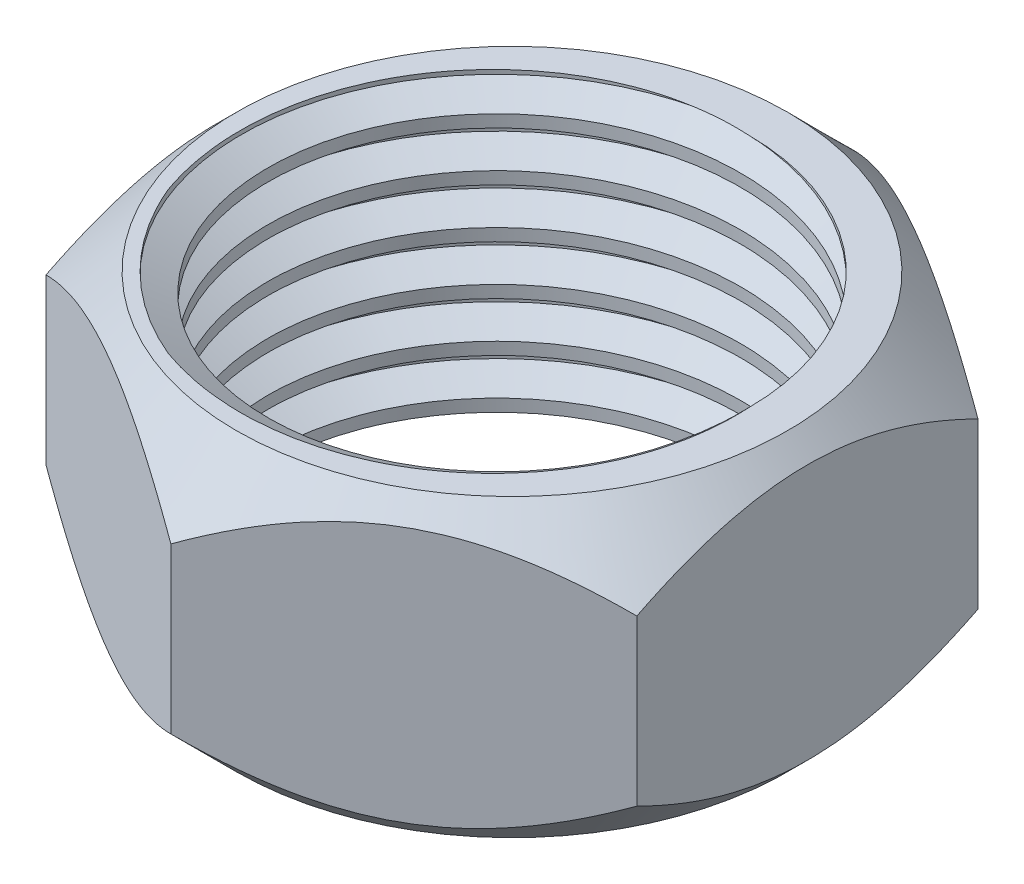
from build123d import *

# Parameters (mm, degrees)
BOSS_EXTRUDE1_DEPTH     = 3.75
SKETCH9_OUTSIDE_W       = 51.208
SKETCH9_OUTSIDE_H       = 53.528
SKETCH9_OUTSIDE_R       = 7
CUT_EXTRUDE3_DEPTH      = 14.693063938
CUT_EXTRUDE3_DRAFT      = -45
MIRROR1_COPY_1_SKETCH_W = 51.208
MIRROR1_COPY_1_SKETCH_H = 53.528
MIRROR1_COPY_1_SKETCH_R = 7
MIRROR1_COPY_1_DEPTH    = 14.693063938
MIRROR1_COPY_1_DRAFT    = -45
SKETCH10_R              = 6
CUT_EXTRUDE4_DEPTH      = 14.693063938
THREAD1_PITCH           = 1.25


with BuildPart() as part:
    # Sketch1 → Boss-Extrude1 (new, symmetric)
    with BuildSketch(Plane(origin=(0, 0, 0), x_dir=(1, 0, 0), z_dir=(0, 1, 0))):
        Polygon((0, 8.660254038), (-7.5, 4.330127019), (-7.5, -4.330127019), (0, -8.660254038), (7.5, -4.330127019), (7.5, 4.330127019), align=None)
    extrude(amount=BOSS_EXTRUDE1_DEPTH, both=True)


with BuildPart() as cut_extrude3_tool:
    # Sketch9 outside → Cut-Extrude3 (with draft: the straight prism first)
    with BuildSketch(Plane(origin=(0, 3.75, 0), x_dir=(1, 0, 0), z_dir=(0, 1, 0))):
        Rectangle(SKETCH9_OUTSIDE_W, SKETCH9_OUTSIDE_H)
        Circle(SKETCH9_OUTSIDE_R, mode=Mode.SUBTRACT)
    extrude(amount=-CUT_EXTRUDE3_DEPTH)
    # Cut-Extrude3: the draft: its side faces are tilted about the plane it starts from
    cut_extrude3_sides = [cut_extrude3_tool.faces().sort_by_distance(p)[0] for p in [
        (0, -3.596531969, 26.764),
        (25.604, -3.596531969, 0),
        (0, -3.596531969, -26.764),
        (-25.604, -3.596531969, 0),
        (-7, -3.596531969, 0),
    ]]
    draft(cut_extrude3_sides, Plane(origin=(0, 3.75, 0), x_dir=(1, 0, 0), z_dir=(0, 1, 0)), CUT_EXTRUDE3_DRAFT)


with BuildPart() as part_1:
    add(part.part)

    # Cut-Extrude3: cut by cut_extrude3_tool
    add(cut_extrude3_tool.part, mode=Mode.SUBTRACT)


with BuildPart() as mirror1_copy_1_tool:
    # Mirror1 copy 1 sketch → Mirror1 copy 1 (with draft: the straight prism first)
    with BuildSketch(Plane.XZ.offset(3.75)):
        Rectangle(MIRROR1_COPY_1_SKETCH_W, MIRROR1_COPY_1_SKETCH_H)
        Circle(MIRROR1_COPY_1_SKETCH_R, mode=Mode.SUBTRACT)
    extrude(amount=-MIRROR1_COPY_1_DEPTH)
    # Mirror1 copy 1: the draft: its side faces are tilted about the plane it starts from
    mirror1_copy_1_sides = [mirror1_copy_1_tool.faces().sort_by_distance(p)[0] for p in [
        (0, 3.596531969, 26.764),
        (25.604, 3.596531969, 0),
        (0, 3.596531969, -26.764),
        (-25.604, 3.596531969, 0),
        (-7, 3.596531969, 0),
    ]]
    draft(mirror1_copy_1_sides, Plane.XZ.offset(3.75), MIRROR1_COPY_1_DRAFT)


with BuildPart() as part_2:
    add(part_1.part)

    # Mirror1 copy 1: cut by mirror1_copy_1_tool
    add(mirror1_copy_1_tool.part, mode=Mode.SUBTRACT)

    # Sketch10 → Cut-Extrude4 (cut, through all)
    with BuildSketch(Plane(origin=(0, 3.75, 0), x_dir=(1, 0, 0), z_dir=(0, 1, 0))):
        with Locations(Location((0, 0, 0), (0, 0, 270))):
            Circle(SKETCH10_R)
    extrude(amount=-CUT_EXTRUDE4_DEPTH, mode=Mode.SUBTRACT)

    # Thread1: arcs per turn and ends read off the stored shape
    # Thread1: the profile of Thread Profile2 profile screwed along a right-hand helix through 7 turns, 8 arcs to a turn; built about Z, then put on its axis
    thread1_z = Axis((0, 0, 0), (0, 0, 1))
    thread1_corners = [(5.9997, 0, -0.000173205), (6.676582344, 0, 0.390624998), (6.676582344, 0, 0.546874998), (5.9997, 0, 0.937673202)]
    with BuildLine(mode=Mode.PRIVATE) as thread1_profile:
        Line(thread1_corners[0], thread1_corners[1])
        Line(thread1_corners[1], thread1_corners[2])
        Line(thread1_corners[2], thread1_corners[3])
        Line(thread1_corners[3], thread1_corners[0])
    thread1_cap = Face(thread1_profile.wire())
    thread1_turn_angles = [0, 22.5, 45, 67.5, 90, 112.5, 135, 157.5, 180, 202.5, 225, 247.5, 270, 292.5, 315, 337.5, 360]
    thread1_turn_weights = [1, 0.9238795325112867, 1, 0.9238795325112867, 1, 0.9238795325112867, 1, 0.9238795325112867, 1, 0.9238795325112867, 1, 0.9238795325112867, 1, 0.9238795325112867, 1, 0.9238795325112867, 1]
    thread1_turn_rails = [Edge.make_bspline([Vector(p[0], p[1], 0).rotate(thread1_z, thread1_turn_angles[k]) / thread1_turn_weights[k] + Vector(0, 0, p[2] + THREAD1_PITCH * thread1_turn_angles[k] / 360) for k in range(17)], [0, 0, 0, 1, 1, 2, 2, 3, 3, 4, 4, 5, 5, 6, 6, 7, 7, 8, 8, 8], 2, thread1_turn_weights) for p in thread1_corners]
    thread1_turn_sides = [Face.make_surface_from_curves(thread1_turn_rails[p[0]], thread1_turn_rails[p[1]]) for p in [(0, 1), (1, 2), (2, 3), (3, 0)]]
    thread1 = Plane(origin=(0, -5, 0), x_dir=(1, 0, 0), z_dir=(0, 1, 0)) * Solid(Shell([*[p.moved(Location((0, 0, THREAD1_PITCH * i))) for i in range(7) for p in thread1_turn_sides], thread1_cap, thread1_cap.rotate(thread1_z, 2520).moved(Location((0, 0, THREAD1_PITCH * 2520 / 360)))]))
    add(thread1, mode=Mode.SUBTRACT)


solid = part_2.part
